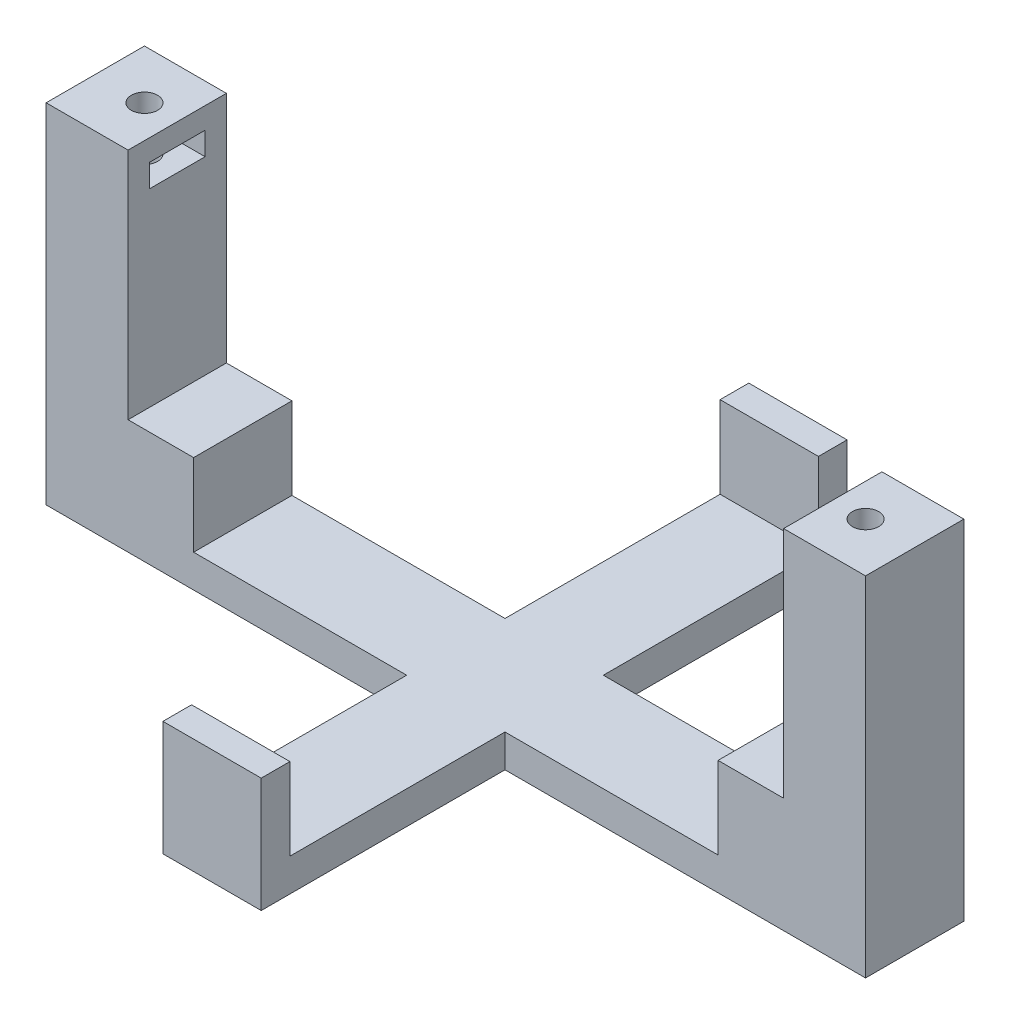
from build123d import *

# Parameters (mm, degrees)
SKETCH2_W         = 100
SKETCH2_H         = 12
SKETCH2_R         = 1.6
SKETCH2_W_2       = 12
SKETCH2_H_2       = 71.5
BODY_DEPTH        = 4
SKETCH4_W         = 10
SKETCH4_H         = 12
SKETCH4_R         = 1.6
WINGS_DEPTH       = 38.5
CAPTIVE_NUT_DEPTH = 8.5
CIRPATTERN1_COUNT = 2
SKETCH8_W         = 12
SKETCH8_H         = 3.5
SKETCH8_W_2       = 8
SKETCH8_H_2       = 12
SLIDE_GUARD_DEPTH = 10


with BuildPart() as part:
    # Sketch2 → body (new body)
    # profile 1 of 2: a face of its own
    with BuildSketch(Plane(origin=(0, 0, 0), x_dir=(1, 0, 0), z_dir=(0, 1, 0))):
        Rectangle(SKETCH2_W, SKETCH2_H)
        with Locations((-44, 0)):
            Circle(SKETCH2_R, mode=Mode.SUBTRACT)
        with Locations((44, 0)):
            Circle(SKETCH2_R, mode=Mode.SUBTRACT)
    # profile 2 of 2: a face of its own
    with BuildSketch(Plane(origin=(0, 0, 0), x_dir=(1, 0, 0), z_dir=(0, 1, 0))):
        Rectangle(SKETCH2_W_2, SKETCH2_H_2)
    extrude(amount=BODY_DEPTH)

    # Sketch4 → wings (add)
    # profile 1 of 2: a face of its own
    with BuildSketch(Plane(origin=(0, 4, 0), x_dir=(1, 0, 0), z_dir=(0, 1, 0))):
        with Locations((-45, 0)):
            Rectangle(SKETCH4_W, SKETCH4_H)
        with Locations((-44, 0)):
            Circle(SKETCH4_R, mode=Mode.SUBTRACT)
    # profile 2 of 2: a face of its own
    with BuildSketch(Plane(origin=(0, 4, 0), x_dir=(1, 0, 0), z_dir=(0, 1, 0))):
        with Locations((45, 0)):
            Rectangle(SKETCH4_W, SKETCH4_H)
        with Locations((44, 0)):
            Circle(SKETCH4_R, mode=Mode.SUBTRACT)
    extrude(amount=WINGS_DEPTH)

    # Sketch6 → captive-nut (cut)
    with BuildSketch(Plane.ZY.offset(-40)):
        Polygon((0, 39.9), (-3.4, 39.9), (-3.4, 37.1), (3.4, 37.1), (3.4, 39.9), align=None)
    captive_nut = extrude(amount=-CAPTIVE_NUT_DEPTH, mode=Mode.SUBTRACT)

    # CirPattern1: captive-nut ×2 about axis
    cirpattern1_axis = Axis((0, 4, 0), (0, 1, 0))
    for i in range(1, CIRPATTERN1_COUNT):
        add(captive_nut.rotate(cirpattern1_axis, i * 360 / CIRPATTERN1_COUNT), mode=Mode.SUBTRACT)

    # Sketch8 → slide-guard (add)
    with BuildSketch(Plane(origin=(0, 4, 0), x_dir=(1, 0, 0), z_dir=(0, 1, 0))):
        with Locations((0, 34)):
            Rectangle(SKETCH8_W, SKETCH8_H)
        with Locations((0, -34)):
            Rectangle(SKETCH8_W, SKETCH8_H)
        with Locations((-36, 0)):
            Rectangle(SKETCH8_W_2, SKETCH8_H_2)
        with Locations((36, 0)):
            Rectangle(SKETCH8_W_2, SKETCH8_H_2)
    extrude(amount=SLIDE_GUARD_DEPTH)


solid = part.part
